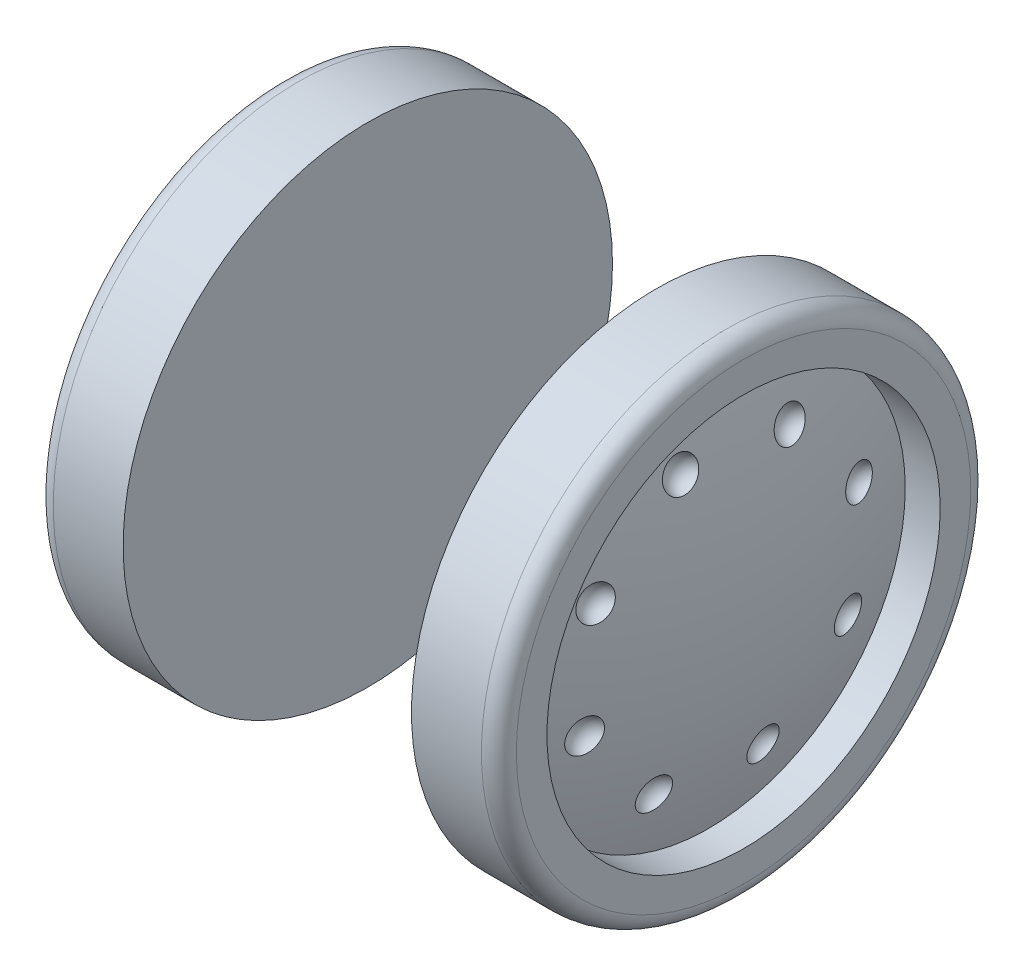
from build123d import *
from build123d.topology import SkipClean

# Parameters (mm, degrees)
SKETCH_1_R               = 14
EXTRUDE_1_DEPTH          = 1.5
EXTRUDE_START            = 2
SKETCH_2_R               = 14
SKETCH_2_R_2             = 11.25
EXTRUDE_2_DEPTH          = 2
PATTERN_CIRCULAR_2_COUNT = 8
FILLET_1_R               = 1


with BuildPart() as part:
    # 草图1 → 凸台-拉伸1 (new, symmetric)
    with BuildSketch(Plane(origin=(-55.25, 0, 0), x_dir=(0, 0, -1), z_dir=(1, 0, 0))):
        with Locations((-29.25, -132.5)):
            Circle(SKETCH_1_R)
    extrude(amount=EXTRUDE_1_DEPTH, both=True)

    # 草图2 → 凸台-拉伸2 (add)
    with BuildSketch(Plane(origin=(-53.75, 0, 0), x_dir=(0, 0, -1), z_dir=(1, 0, 0)).offset(EXTRUDE_START)):
        with Locations((-29.25, -132.5)):
            Circle(SKETCH_2_R)
        with Locations((-29.25, -132.5)):
            Circle(SKETCH_2_R_2, mode=Mode.SUBTRACT)
    extrude(amount=-EXTRUDE_2_DEPTH)

    # 草图3 → 旋转1 (revolve)
    with SkipClean():  # the faces are left unmerged after this step: merging them gives an invalid solid
        with BuildSketch(Plane(origin=(0, -132.5, 0), x_dir=(1, 0, 0), z_dir=(0, 1, 0)), mode=Mode.PRIVATE) as revolve_1_sk:
            with BuildLine():
                Line((-53.75, -29.25), (-53.75, -40.5))
                ThreePointArc((-53.75, -40.5), (-52.541093529, -34.932637888), (-52.135381332, -29.25))
                Line((-52.135381332, -29.25), (-53.75, -29.25))
            make_face()
            with BuildLine():
                Line((-53.75, -18), (-53.75, -29.25))
                Line((-53.75, -29.25), (-52.135381332, -29.25))
                ThreePointArc((-52.135381332, -29.25), (-52.541093529, -23.567362112), (-53.75, -18))
            make_face()
        revolve(revolve_1_sk.sketch.rotate(Axis((-52.135381332, -132.5, 29.25), (-1, 0, 0)), 180), axis=Axis((-52.135381332, -132.5, 29.25), (-1, 0, 0)))
    add(part.part.scale(1), mode=Mode.REPLACE)  # the faces are merged on a copy


with BuildPart() as body_2:
    # 草图4 → 旋转2 (revolve)
    with SkipClean():  # the faces are left unmerged after this step: merging them gives an invalid solid
        with BuildSketch(Plane(origin=(-51.75, 0, 0), x_dir=(0, 0, -1), z_dir=(1, 0, 0)), mode=Mode.PRIVATE) as revolve_2_sk:
            with BuildLine():
                ThreePointArc((-24.866905933, -124.354388519), (-26.221360587, -124.761147158), (-25.814601947, -126.115601812))
                Line((-25.814601947, -126.115601812), (-24.866905933, -124.354388519))
            make_face()
            with BuildLine():
                Line((-24.866905933, -124.354388519), (-25.814601947, -126.115601812))
                ThreePointArc((-25.814601947, -126.115601812), (-24.827844595, -126.093437944), (-24.34075394, -125.234995166))
                ThreePointArc((-24.34075394, -125.234995166), (-24.482311162, -124.722085821), (-24.866905933, -124.354388519))
            make_face()
        revolve(revolve_2_sk.sketch.rotate(Axis((-51.75, -132.5, 29.25), (0, 0.8806066465842294, -0.473848007267814)), 180), axis=Axis((-51.75, -132.5, 29.25), (0, 0.8806066465842294, -0.473848007267814)))
    add(body_2.part.scale(1), mode=Mode.REPLACE)  # the faces are merged on a copy


with BuildPart() as body_2_1:
    # Move Body 2: moved
    add(body_2.part.moved(Location((-1, 0, 0))))


with BuildPart() as pattern_circular_2_1:
    # 阵列(圆周)2: pattern copy
    add(body_2_1.part.rotate(Axis((0, -132.5, 29.25), (1, 0, 0)), 1 * 360 / PATTERN_CIRCULAR_2_COUNT))


with BuildPart() as pattern_circular_2_2:
    # 阵列(圆周)2: pattern copy
    add(body_2_1.part.rotate(Axis((0, -132.5, 29.25), (1, 0, 0)), 2 * 360 / PATTERN_CIRCULAR_2_COUNT))


with BuildPart() as pattern_circular_2_3:
    # 阵列(圆周)2: pattern copy
    add(body_2_1.part.rotate(Axis((0, -132.5, 29.25), (1, 0, 0)), 3 * 360 / PATTERN_CIRCULAR_2_COUNT))


with BuildPart() as pattern_circular_2_4:
    # 阵列(圆周)2: pattern copy
    add(body_2_1.part.rotate(Axis((0, -132.5, 29.25), (1, 0, 0)), 4 * 360 / PATTERN_CIRCULAR_2_COUNT))


with BuildPart() as pattern_circular_2_5:
    # 阵列(圆周)2: pattern copy
    add(body_2_1.part.rotate(Axis((0, -132.5, 29.25), (1, 0, 0)), 5 * 360 / PATTERN_CIRCULAR_2_COUNT))


with BuildPart() as pattern_circular_2_6:
    # 阵列(圆周)2: pattern copy
    add(body_2_1.part.rotate(Axis((0, -132.5, 29.25), (1, 0, 0)), 6 * 360 / PATTERN_CIRCULAR_2_COUNT))


with BuildPart() as pattern_circular_2_7:
    # 阵列(圆周)2: pattern copy
    add(body_2_1.part.rotate(Axis((0, -132.5, 29.25), (1, 0, 0)), 7 * 360 / PATTERN_CIRCULAR_2_COUNT))


with BuildPart() as part_1:
    add(part.part)

    # Combine 2: read off the stored shape, not the designer's step
    # Combine 2: cut body 2, 阵列(圆周)2_1, 阵列(圆周)2_7, 阵列(圆周)2_6, 阵列(圆周)2_5, 阵列(圆周)2_4, 阵列(圆周)2_3, 阵列(圆周)2_2
    add(body_2_1.part, mode=Mode.SUBTRACT)
    add(pattern_circular_2_1.part, mode=Mode.SUBTRACT)
    add(pattern_circular_2_7.part, mode=Mode.SUBTRACT)
    add(pattern_circular_2_6.part, mode=Mode.SUBTRACT)
    add(pattern_circular_2_5.part, mode=Mode.SUBTRACT)
    add(pattern_circular_2_4.part, mode=Mode.SUBTRACT)
    add(pattern_circular_2_3.part, mode=Mode.SUBTRACT)
    add(pattern_circular_2_2.part, mode=Mode.SUBTRACT)

    # 圆角1
    fillet_1_edges = [part_1.edges().sort_by_distance(p)[0] for p in [
        (-51.75, -132.5, 43.25),
    ]]
    fillet(fillet_1_edges, radius=FILLET_1_R)


with BuildPart() as body_2_2:
    # 镜向1: mirrored copy
    add(part_1.part.mirror(Plane(origin=(-65, 0, 0), x_dir=(0, 0, 1), z_dir=(1, 0, 0))))


solid = Compound([part_1.part, body_2_2.part])
